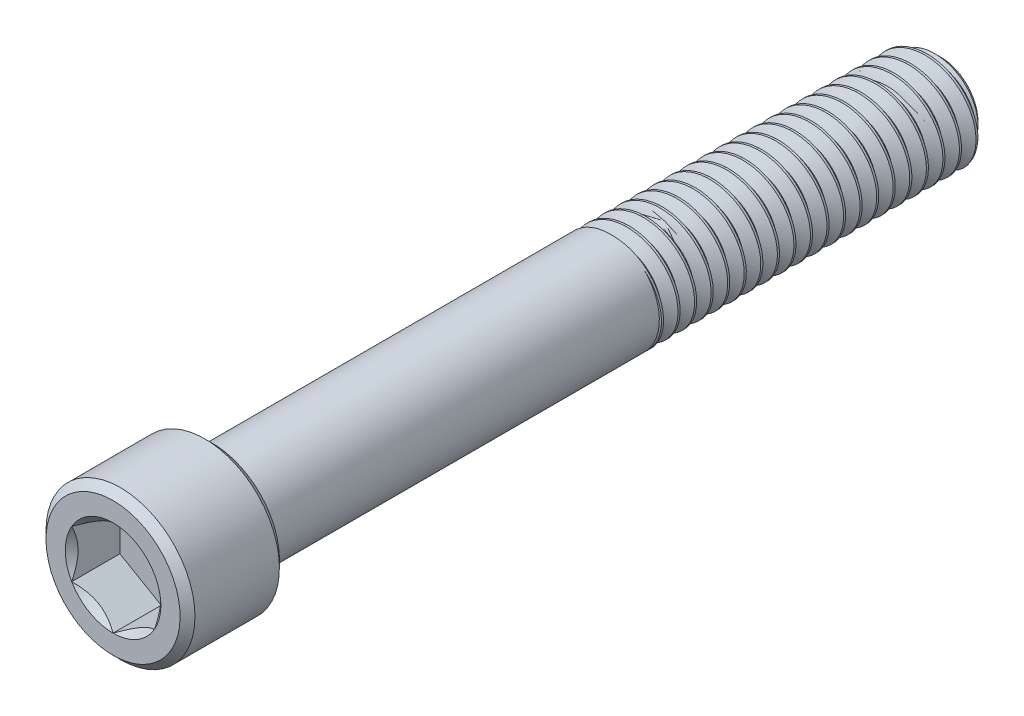
from build123d import *

# Parameters (mm, degrees)
CUT_EXTRUDE1_DEPTH  = 4.6228
CHAMFER1_SIZE       = 0.714375
CUT_SWEEP1_PITCH    = 1.5875
CUT_SWEEP1_TO       = 69.85
SKETCH8_R           = 5.159375
BOSS_EXTRUDE1_DEPTH = 2.54
BOSS_EXTRUDE1_TAPER = 60
SKETCH9_R           = 4.7625
BOSS_EXTRUDE2_DEPTH = 38.1


with BuildPart() as part:
    # Sketch3 → Revolve1 (revolve)
    with BuildSketch(Plane(origin=(0, 0, 0), x_dir=(0, 0, -1), z_dir=(1, 0, 0)), mode=Mode.PRIVATE) as revolve1_sk:
        Polygon((-39.6875, 7.14375), (-39.6875, 3.96875), (-35.0647, 3.96875), (-35.0647, 0), (39.6875, 0), (39.6875, 3.571875), (38.496875, 4.7625), (-30.1625, 4.7625), (-30.1625, 7.14375), align=None)
    revolve(revolve1_sk.sketch.rotate(Axis((0, 0, 39.6875), (0, 0, -1)), 180), axis=Axis((0, 0, 39.6875), (0, 0, -1)))

    # Sketch4 → Cut-Extrude1 (cut)
    with BuildSketch(Plane.XY.offset(39.6875)):
        Polygon((0, 4.582717762), (-3.96875, 2.291358881), (-3.96875, -2.291358881), (0, -4.582717762), (3.96875, -2.291358881), (3.96875, 2.291358881), align=None)
    extrude(amount=-CUT_EXTRUDE1_DEPTH, mode=Mode.SUBTRACT)

    # Cut-Extrude2 cone 1 section (through the dimple's axis) → Cut-Extrude2 (revolve, cut)
    with BuildSketch(Plane(origin=(0, 0, 39.6875), x_dir=(0, -1, 0), z_dir=(1, 0, 0))):
        Polygon((0, 0), (4.582717762, 0), (0, 4.582717762), align=None)
    revolve(axis=Axis((0, 0, 39.6875), (0, 0, -1)), mode=Mode.SUBTRACT)

    # Chamfer1
    chamfer1_edges = [part.edges().sort_by_distance(p)[0] for p in [
        (0, 7.14375, 39.6875),
        (0, 7.14375, 30.1625),
    ]]
    chamfer(chamfer1_edges, length=CHAMFER1_SIZE)


with BuildPart() as body_2:
    # Split1: read off the stored shape, not the designer's step
    # Split1: the piece on the far side of the plane
    add(part.part)
    split(bisect_by=Plane.XY.offset(30.1625), keep=Keep.BOTTOM)

    # Cut-Sweep1: arcs per turn and ends read off the stored shape
    # Cut-Sweep1: the profile of Sketch7 screwed along a right-hand helix through 45 turns, 8 arcs to a turn; built about Z, then put on its axis
    cut_sweep1_z = Axis((0, 0, 0), (0, 0, 1))
    cut_sweep1_corners = [(3.731388504, 0, -0.5953125), (3.731388504, 0, -0.79375), (4.848425958, 0, -1.438671875), (4.848425958, 0, 0.049609375)]
    with BuildLine(mode=Mode.PRIVATE) as cut_sweep1_profile:
        Line(cut_sweep1_corners[0], cut_sweep1_corners[1])
        Line(cut_sweep1_corners[1], cut_sweep1_corners[2])
        Line(cut_sweep1_corners[2], cut_sweep1_corners[3])
        Line(cut_sweep1_corners[3], cut_sweep1_corners[0])
    cut_sweep1_cap = Face(cut_sweep1_profile.wire())
    cut_sweep1_turn_angles = [0, 22.5, 45, 67.5, 90, 112.5, 135, 157.5, 180, 202.5, 225, 247.5, 270, 292.5, 315, 337.5, 360]
    cut_sweep1_turn_weights = [1, 0.9238795325112867, 1, 0.9238795325112867, 1, 0.9238795325112867, 1, 0.9238795325112867, 1, 0.9238795325112867, 1, 0.9238795325112867, 1, 0.9238795325112867, 1, 0.9238795325112867, 1]
    cut_sweep1_turn_rails = [Edge.make_bspline([Vector(p[0], p[1], 0).rotate(cut_sweep1_z, cut_sweep1_turn_angles[k]) / cut_sweep1_turn_weights[k] + Vector(0, 0, p[2] + CUT_SWEEP1_PITCH * cut_sweep1_turn_angles[k] / 360) for k in range(17)], [0, 0, 0, 1, 1, 2, 2, 3, 3, 4, 4, 5, 5, 6, 6, 7, 7, 8, 8, 8], 2, cut_sweep1_turn_weights) for p in cut_sweep1_corners]
    cut_sweep1_turn_sides = [Face.make_surface_from_curves(cut_sweep1_turn_rails[p[0]], cut_sweep1_turn_rails[p[1]]) for p in [(0, 1), (1, 2), (2, 3), (3, 0)]]
    cut_sweep1 = Plane(origin=(0, 0, -39.6875), x_dir=(0, 1, 0), z_dir=(0, 0, 1)) * split(Solid(Shell([*[p.moved(Location((0, 0, CUT_SWEEP1_PITCH * i))) for i in range(45) for p in cut_sweep1_turn_sides], cut_sweep1_cap, cut_sweep1_cap.rotate(cut_sweep1_z, 16200).moved(Location((0, 0, CUT_SWEEP1_PITCH * 16200 / 360)))])), bisect_by=Plane.XY.offset(CUT_SWEEP1_TO), keep=Keep.BOTTOM, mode=Mode.PRIVATE)
    add(cut_sweep1, mode=Mode.SUBTRACT)


with BuildPart() as part_1:
    add(part.part)

    # Split1
    split(bisect_by=Plane.XY.offset(30.1625), keep=Keep.TOP)

    add(body_2.part)  # Boss-Extrude1 merges body 2
    # Sketch8 → Boss-Extrude1 (add)
    with BuildSketch(Plane(origin=(0, 0, 30.1625), x_dir=(-1, 0, 0), z_dir=(0, 0, -1))):
        Circle(SKETCH8_R)
    extrude(amount=BOSS_EXTRUDE1_DEPTH, taper=BOSS_EXTRUDE1_TAPER)

    # Sketch9 → Boss-Extrude2 (add)
    with BuildSketch(Plane(origin=(0, 0, 30.1625), x_dir=(-1, 0, 0), z_dir=(0, 0, -1))):
        with Locations(Location((0, 0, 0), (0, 0, 90))):
            Circle(SKETCH9_R)
    extrude(amount=BOSS_EXTRUDE2_DEPTH)


solid = part_1.part
